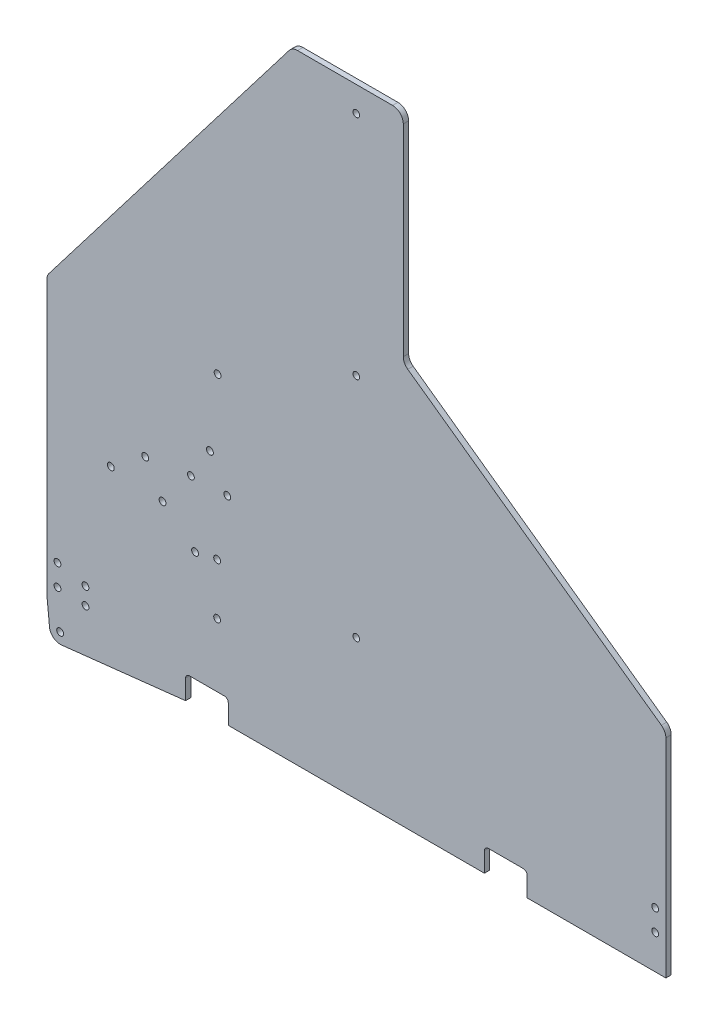
from build123d import *

# Parameters (mm, degrees)
SKETCH1_R           = 2.032
SKETCH1_R_2         = 2
BOSS_EXTRUDE1_DEPTH = 3.175
FILLET1_R           = 2.286
FILLET2_R           = 6.35
SKETCH2_R           = 2.032
CUT_EXTRUDE1_DEPTH  = 507.700158896


with BuildPart() as part:
    # Sketch1 → Boss-Extrude1 (new body)
    with BuildSketch(Plane.XY):
        with BuildLine():
            Line((8.639060666, -28.536126099), (82.55, -20.32))
            Line((82.55, -20.32), (82.55, -6.35))
            Line((82.55, -6.35), (107.95, -6.35))
            Line((107.95, -6.35), (107.95, -20.32))
            Line((107.95, -20.32), (260.35, -20.32))
            Line((260.35, -20.32), (260.35, -6.35))
            Line((260.35, -6.35), (285.75, -6.35))
            Line((285.75, -6.35), (285.75, -20.32))
            Line((285.75, -20.32), (368.3, -20.32))
            Line((368.3, -20.32), (368.3, 106.68))
            Line((368.3, 106.68), (212.09, 218.44))
            Line((212.09, 218.44), (212.09, 347.98))
            Line((212.09, 347.98), (184.15, 347.98))
            Line((184.15, 347.98), (146.05, 347.98))
            Line((146.05, 347.98), (0, 157.48))
            Line((0, 157.48), (0, 0))
            Line((0, 0), (0, -6.35))
            ThreePointArc((0, -6.35), (0.007883354, -6.666317007), (0.031513842, -6.981848616))
            Line((0.031513842, -6.981848616), (1.619013842, -22.856848616))
            ThreePointArc((1.619013842, -22.856848616), (3.943628298, -27.161748811), (8.639060666, -28.536126099))
        make_face()
        with Locations((7.9375, -22.225)):
            Circle(SKETCH1_R, mode=Mode.SUBTRACT)
        with Locations((6.35, 0)):
            Circle(SKETCH1_R, mode=Mode.SUBTRACT)
        with Locations((6.35, 12.7)):
            Circle(SKETCH1_R, mode=Mode.SUBTRACT)
        with Locations((88.216909404, 59.136578314)):
            Circle(SKETCH1_R, mode=Mode.SUBTRACT)
        with Locations((184.15, 62.98)):
            Circle(SKETCH1_R_2, mode=Mode.SUBTRACT)
        with Locations((38.1, 78.105)):
            Circle(SKETCH1_R, mode=Mode.SUBTRACT)
        with Locations((68.887329744, 75.518700365)):
            Circle(SKETCH1_R, mode=Mode.SUBTRACT)
        with Locations((58.568579744, 93.391299635)):
            Circle(SKETCH1_R, mode=Mode.SUBTRACT)
        with Locations((85.725, 97.155)):
            Circle(SKETCH1_R, mode=Mode.SUBTRACT)
        with Locations((107.382158942, 97.743700365)):
            Circle(SKETCH1_R, mode=Mode.SUBTRACT)
        with Locations((97.063408942, 115.616299635)):
            Circle(SKETCH1_R, mode=Mode.SUBTRACT)
        with Locations((101.6, 157.48)):
            Circle(SKETCH1_R, mode=Mode.SUBTRACT)
        with Locations((361.95, 0)):
            Circle(SKETCH1_R, mode=Mode.SUBTRACT)
        with Locations((361.95, 12.7)):
            Circle(SKETCH1_R, mode=Mode.SUBTRACT)
        with Locations((184.15, 197.98)):
            Circle(SKETCH1_R_2, mode=Mode.SUBTRACT)
        with Locations((184.15, 332.98)):
            Circle(SKETCH1_R_2, mode=Mode.SUBTRACT)
    extrude(amount=BOSS_EXTRUDE1_DEPTH)

    # Fillet1
    fillet1_edges = [part.edges().sort_by_distance(p)[0] for p in [
        (285.75, -6.35, 1.5875),
        (107.95, -6.35, 1.5875),
        (260.35, -6.35, 1.5875),
        (82.55, -6.35, 1.5875),
    ]]
    fillet(fillet1_edges, radius=FILLET1_R)

    # Fillet2
    fillet2_edges = [part.edges().sort_by_distance(p)[0] for p in [
        (0, 157.48, 1.5875),
        (212.09, 347.98, 1.5875),
        (212.09, 218.44, 1.5875),
        (368.3, 106.68, 1.5875),
        (146.05, 347.98, 1.5875),
    ]]
    fillet(fillet2_edges, radius=FILLET2_R)

    # Sketch2 → Cut-Extrude1 (cut, through all)
    with BuildSketch(Plane(origin=(0, 0, 0), x_dir=(-1, 0, 0), z_dir=(0, 0, -1))):
        with Locations((-101.339768613, 61.847479268)):
            Circle(SKETCH2_R)
        with Locations((-101.339768613, 31.367479268)):
            Circle(SKETCH2_R)
        with Locations((-23.011998341, 8.96398506)):
            Circle(SKETCH2_R)
        with Locations((-23.011998341, -1.19601494)):
            Circle(SKETCH2_R)
    extrude(amount=-CUT_EXTRUDE1_DEPTH, mode=Mode.SUBTRACT)


solid = part.part
